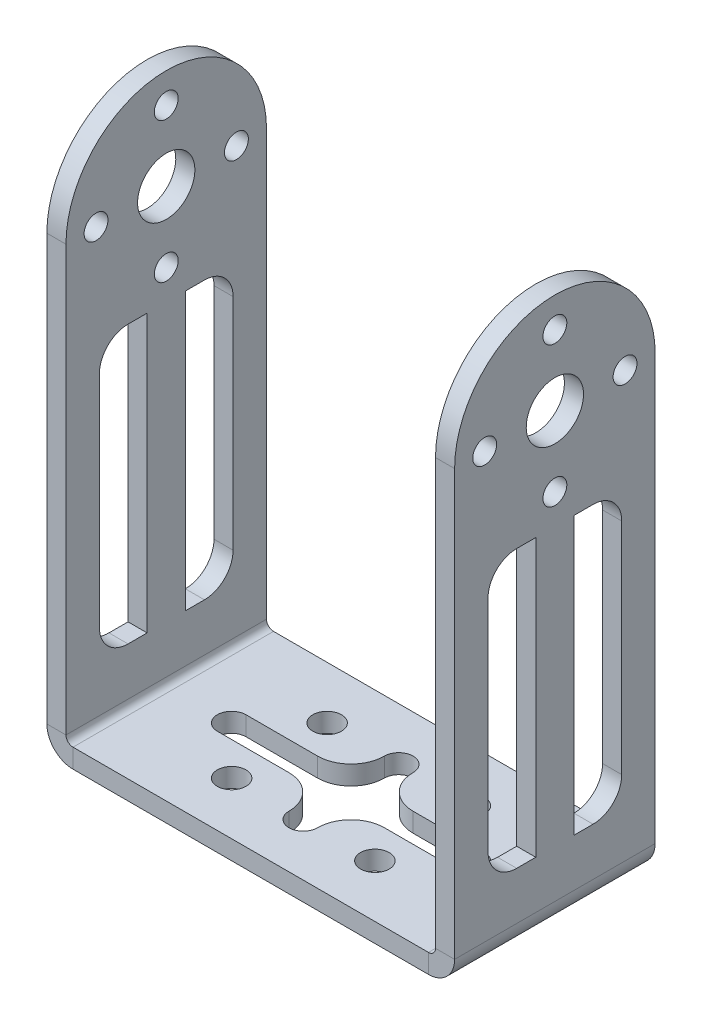
from build123d import *

# Parameters (mm, degrees)
CROQUIS2_W                  = 152.7
CROQUIS2_H                  = 21
BRIDA_BASE1_DEPTH           = 2
PLIEGUE_START               = -10.5
PLIEGUE_CROQUIZADO1_DEPTH   = 21
PLIEGUE_CROQUIZADO1_2_DEPTH = 21
CROQUIS8_R                  = 1.25
CROQUIS8_R_2                = 3
CORTAR_EXTRUIR1_DEPTH       = 72.000595879
CROQUIS9_R                  = 1.5
CORTAR_EXTRUIR2_DEPTH       = 2


# Read off the part's stored shape, not the designer's step: Pliegue croquizado1
# Sheet-metal steps are written as plain solids
with BuildPart() as part:
    # Croquis2 → Brida base1 (new body)
    with BuildSketch(Plane(origin=(0, 0, 0), x_dir=(1, 0, 0), z_dir=(0, 1, 0))):
        Rectangle(CROQUIS2_W, CROQUIS2_H)
    extrude(amount=-BRIDA_BASE1_DEPTH)

    # Pliegue croquizado1 outline → Pliegue croquizado1 (cut)
    with BuildSketch(Plane.XY.offset(PLIEGUE_START)):
        with BuildLine():
            Line((-76.35, -2), (-18.6134, -2))
            ThreePointArc((-18.6134, -2), (-20.267667209, -1.443395312), (-21.249002398, 0))
            Line((-21.249002398, 0), (-76.35, 0))
            Line((-76.35, 0), (-76.35, -2))
        make_face()
        with BuildLine():
            ThreePointArc((21.249002398, 0), (20.267667209, -1.443395312), (18.6134, -2))
            Line((18.6134, -2), (76.35, -2))
            Line((76.35, -2), (76.35, 0))
            Line((76.35, 0), (21.249002398, 0))
        make_face()
    extrude(amount=PLIEGUE_CROQUIZADO1_DEPTH, mode=Mode.SUBTRACT)

    # Pliegue croquizado1 2 outline → Pliegue croquizado1 2 (add)
    with BuildSketch(Plane.XY.offset(PLIEGUE_START)):
        with BuildLine():
            ThreePointArc((-21.35, 0.7366), (-21.324633029, 0.364854094), (-21.249002398, 0))
            Line((-21.249002398, 0), (-18.6134, 0))
            ThreePointArc((-18.6134, 0), (-19.134254855, 0.215745145), (-19.35, 0.7366))
            Line((-19.35, 0.7366), (-19.35, 55.745355099))
            Line((-19.35, 55.745355099), (-21.35, 55.745355099))
            Line((-21.35, 55.745355099), (-21.35, 0.7366))
        make_face()
        with BuildLine():
            Line((18.6134, 0), (21.249002398, 0))
            ThreePointArc((21.249002398, 0), (21.324633029, 0.364854094), (21.35, 0.7366))
            Line((21.35, 0.7366), (21.35, 55.745355099))
            Line((21.35, 55.745355099), (19.35, 55.745355099))
            Line((19.35, 55.745355099), (19.35, 0.7366))
            ThreePointArc((19.35, 0.7366), (19.134254855, 0.215745145), (18.6134, 0))
        make_face()
    extrude(amount=PLIEGUE_CROQUIZADO1_2_DEPTH)

    # Croquis8 → Cortar-Extruir1 (cut, through all)
    with BuildSketch(Plane(origin=(21.35, 0, 0), x_dir=(0, 0, -1), z_dir=(1, 0, 0))):
        with BuildLine():
            Line((-7, 8.745355099), (-7, 31.745355099))
            ThreePointArc((-7, 31.745355099), (-6.121320344, 33.866675442), (-4, 34.745355099))
            Line((-4, 34.745355099), (-2, 34.745355099))
            Line((-2, 34.745355099), (-2, 5.745355099))
            Line((-2, 5.745355099), (-4, 5.745355099))
            ThreePointArc((-4, 5.745355099), (-6.121320344, 6.624034755), (-7, 8.745355099))
        make_face()
        with BuildLine():
            Line((2, 5.745355099), (4, 5.745355099))
            ThreePointArc((4, 5.745355099), (6.121320344, 6.624034755), (7, 8.745355099))
            Line((7, 8.745355099), (7, 31.745355099))
            ThreePointArc((7, 31.745355099), (6.121320344, 33.866675442), (4, 34.745355099))
            Line((4, 34.745355099), (2, 34.745355099))
            Line((2, 34.745355099), (2, 5.745355099))
        make_face()
        with BuildLine():
            ThreePointArc((0, 55.745355099), (7.424621202, 52.669976301), (10.5, 45.245355099))
            Line((10.5, 45.245355099), (10.5, 55.745355099))
            Line((10.5, 55.745355099), (0, 55.745355099))
        make_face()
        with BuildLine():
            ThreePointArc((-10.5, 45.245355099), (-7.424621202, 52.669976301), (0, 55.745355099))
            Line((0, 55.745355099), (-10.5, 55.745355099))
            Line((-10.5, 55.745355099), (-10.5, 45.245355099))
        make_face()
        with Locations(Location((-7.35, 45.245355099, 0), (0, 0, 90))):
            Circle(CROQUIS8_R)
        with Locations(Location((0, 37.895355099, 0), (0, 0, 90))):
            Circle(CROQUIS8_R)
        with Locations(Location((7.35, 45.245355099, 0), (0, 0, 90))):
            Circle(CROQUIS8_R)
        with Locations(Location((0, 52.595355099, 0), (0, 0, 90))):
            Circle(CROQUIS8_R)
        with Locations(Location((0, 45.245355099, 0), (0, 0, 90))):
            Circle(CROQUIS8_R_2)
    extrude(amount=-CORTAR_EXTRUIR1_DEPTH, mode=Mode.SUBTRACT)

    # Croquis9 → Cortar-Extruir2 (cut)
    with BuildSketch(Plane(origin=(0, 0, 0), x_dir=(1, 0, 0), z_dir=(0, 1, 0))):
        with Locations(Location((-7.5, 5, 0), (0, 0, 270))):
            Circle(CROQUIS9_R)
        with Locations(Location((-7.5, -5, 0), (0, 0, 270))):
            Circle(CROQUIS9_R)
        with Locations(Location((7.5, -5, 0), (0, 0, 90))):
            Circle(CROQUIS9_R)
        with Locations(Location((7.5, 5, 0), (0, 0, 90))):
            Circle(CROQUIS9_R)
        with BuildLine():
            Line((-5, 1.5), (-12.5, 1.5))
            ThreePointArc((-12.5, 1.5), (-14, 0), (-12.5, -1.5))
            Line((-12.5, -1.5), (-5, -1.5))
            ThreePointArc((-5, -1.5), (-2.525126266, -2.525126266), (-1.5, -5))
            ThreePointArc((-1.5, -5), (0, -6.5), (1.5, -5))
            ThreePointArc((1.5, -5), (2.525126266, -2.525126266), (5, -1.5))
            Line((5, -1.5), (12.5, -1.5))
            ThreePointArc((12.5, -1.5), (14, 0), (12.5, 1.5))
            Line((12.5, 1.5), (5, 1.5))
            ThreePointArc((5, 1.5), (2.525126266, 2.525126266), (1.5, 5))
            ThreePointArc((1.5, 5), (0, 6.5), (-1.5, 5))
            ThreePointArc((-1.5, 5), (-2.525126266, 2.525126266), (-5, 1.5))
        make_face()
    extrude(amount=-CORTAR_EXTRUIR2_DEPTH, mode=Mode.SUBTRACT)


solid = part.part
